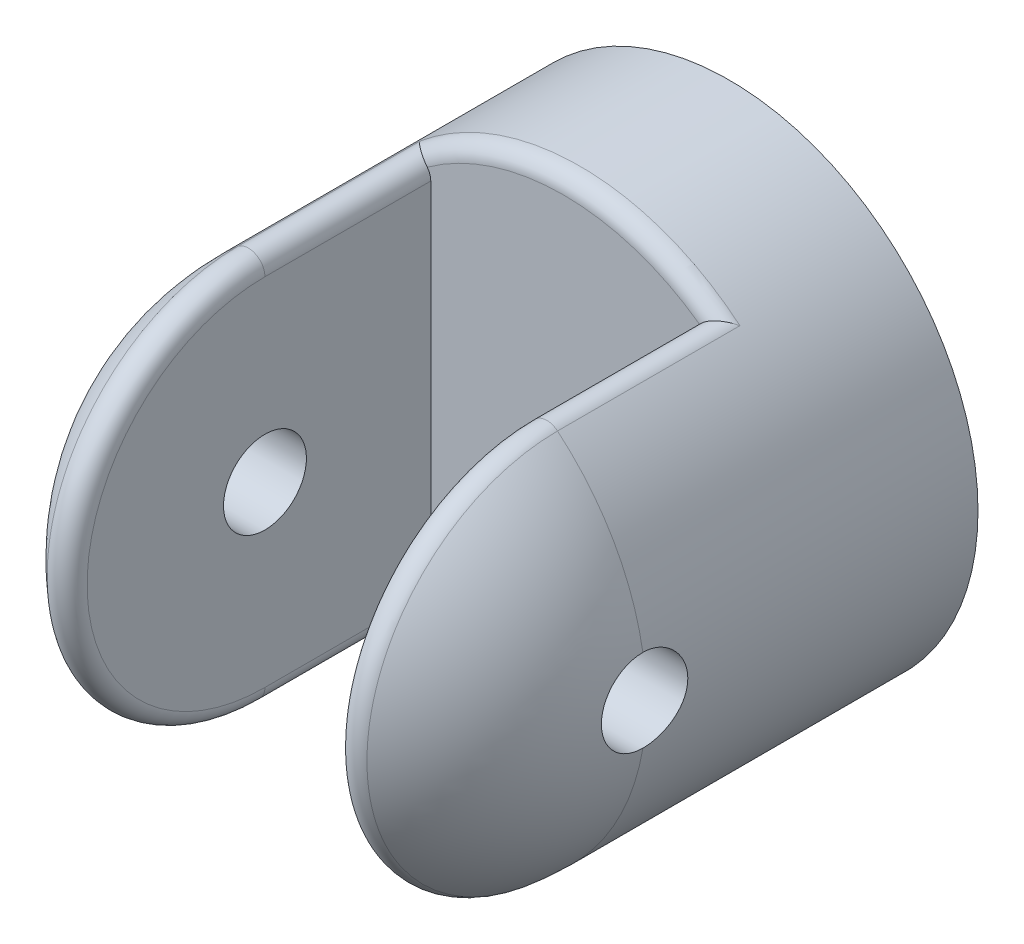
from build123d import *

# Parameters (mm, degrees)
CROQUIS1_R                 = 7.5
SALIENTE_EXTRUIR1_DEPTH    = 10
C_PULA1_FACE_RADIUS        = 7.5
C_PULA1_HEIGHT             = 7.5
CORTAR_EXTRUIR1_DEPTH      = 10
CORTAR_EXTRUIR1_DEPTH_BACK = 19
CORTAR_EXTRUIR2_DEPTH      = 11
CORTAR_EXTRUIR2_DEPTH_BACK = 19
CROQUIS3_R                 = 1.25
REDONDEO1_R                = 0.5


with BuildPart() as part:
    # Croquis1 → Saliente-Extruir1 (new body)
    with BuildSketch(Plane.XY):
        Circle(CROQUIS1_R)
    extrude(amount=SALIENTE_EXTRUIR1_DEPTH)

    # Cúpula1: a dome of height H over a round flat face of radius A is a cap of a sphere of radius (A * A + H * H) / (2 * H)
    c_pula1_r = (C_PULA1_FACE_RADIUS * C_PULA1_FACE_RADIUS + C_PULA1_HEIGHT * C_PULA1_HEIGHT) / (2 * C_PULA1_HEIGHT)
    c_pula1_base = Plane((0, 0, 10), z_dir=(0, 0, 1))
    with Locations(c_pula1_base.offset(C_PULA1_HEIGHT - c_pula1_r)):
        c_pula1_ball = Sphere(c_pula1_r, mode=Mode.PRIVATE)
    add(split(c_pula1_ball, bisect_by=c_pula1_base, keep=Keep.TOP, mode=Mode.PRIVATE))

    # Croquis2 → Cortar-Extruir1 (cut, two sides: drawn at the far end of the back side and taken through both)
    with BuildSketch(Plane(origin=(0, 0, 0), x_dir=(1, 0, 0), z_dir=(0, 1, 0)).offset(-CORTAR_EXTRUIR1_DEPTH_BACK)):
        Polygon((-4, -10), (-4, -17.5), (4, -17.5), (4, -9.5), (4, -5), (-4, -5), align=None)
    extrude(amount=CORTAR_EXTRUIR1_DEPTH + CORTAR_EXTRUIR1_DEPTH_BACK, mode=Mode.SUBTRACT)

    # Croquis3 → Cortar-Extruir2 (cut, two sides: drawn at the far end of the back side and taken through both)
    with BuildSketch(Plane(origin=(0, 0, 0), x_dir=(0, 0, -1), z_dir=(1, 0, 0)).offset(-CORTAR_EXTRUIR2_DEPTH_BACK)):
        with Locations(Location((-10, 0, 0), (0, 0, 270))):
            Circle(CROQUIS3_R)
    extrude(amount=CORTAR_EXTRUIR2_DEPTH + CORTAR_EXTRUIR2_DEPTH_BACK, mode=Mode.SUBTRACT)

    # Redondeo1
    # the kernel refuses this fillet: 0.5 mm, written as the material it takes off along each edge
    with BuildSketch(Plane(origin=(0, 0, 5), x_dir=(-0.6663010614300323, 0.7456828384354923, 0), z_dir=(-0.7456828384354923, -0.6663010614300323, 0))) as redondeo1_piece_1_section:
        with BuildLine():
            CenterArc((7.5 - REDONDEO1_R, REDONDEO1_R), REDONDEO1_R, 270, 90)
            Line((7.5 - REDONDEO1_R, 0), (7.5, 0))
            Line((7.5, 0), (7.5, REDONDEO1_R))
        make_face()
    redondeo1_piece_1 = revolve(axis=Axis((0, 0, 5), (0, 0, -1)), revolution_arc=83.564433706, mode=Mode.PRIVATE)
    redondeo1_piece_1 = split(redondeo1_piece_1, bisect_by=Plane(origin=(4, 7.359307854, 4.859307854), z_dir=(-1, 0, 0)), keep=Keep.TOP, mode=Mode.PRIVATE)
    redondeo1_piece_1 = split(redondeo1_piece_1, bisect_by=Plane(origin=(-4, 7.359307854, 4.859307854), z_dir=(1, 0, 0)), keep=Keep.TOP, mode=Mode.PRIVATE)
    add(redondeo1_piece_1, mode=Mode.SUBTRACT)
    with BuildSketch(Plane(origin=(4, -6.34428877, 10), x_dir=(0.807803952835934, 0.5894512480117758, 0), z_dir=(0, 0, -1)), Plane(origin=(-4, 6.34428877, 10), x_dir=(-0.8078039528359331, -0.5894512480117771, 0), z_dir=(0, 0, -1))) as redondeo1_piece_2:
        with BuildLine():
            CenterArc((0.982970703, -0.498849769), REDONDEO1_R, 86.112875875, 130.005200885)
            Line((0.579068726, -0.793575393), (0, 0))
            ThreePointArc((0, 0), (0.508433122, 0.017253461), (1.016866244, 0))
        make_face()
    extrude(amount=5, mode=Mode.SUBTRACT)
    with BuildSketch(Plane(origin=(4, 6.34428877, 10), x_dir=(0.8078039528359339, -0.5894512480117758, 0), z_dir=(0, 0, -1)), Plane(origin=(-4, -6.34428877, 10), x_dir=(-0.8078039528359333, 0.5894512480117767, 0), z_dir=(0, 0, -1))) as redondeo1_piece_3:
        with BuildLine():
            CenterArc((0.982970703, 0.498849769), REDONDEO1_R, 143.88192324, 130.005200885)
            Line((0.579068726, 0.793575393), (0, 0))
            ThreePointArc((0, 0), (0.508433122, -0.017253461), (1.016866244, 0))
        make_face()
    extrude(amount=5, mode=Mode.SUBTRACT)
    with BuildSketch(Plane(origin=(-4, 0, 10), x_dir=(0, 1, 0), z_dir=(0, 0, -1))) as redondeo1_piece_4:
        with BuildLine():
            CenterArc((5.361902647, -0.5), REDONDEO1_R, 319.994799115, 130.005200885)
            ThreePointArc((5.744895694, -0.821428571), (6.058529646, -0.42088436), (6.34428877, 0))
            Line((6.34428877, 0), (5.361902647, 0))
        make_face()
    revolve(axis=Axis((-4, 0, 10), (1, 0, 0)), revolution_arc=180, mode=Mode.SUBTRACT)
    with BuildSketch(Plane(origin=(4, 0, 10), x_dir=(0, 1, 0), z_dir=(0, 0, -1))) as redondeo1_piece_5:
        with BuildLine():
            CenterArc((5.361902647, 0.5), REDONDEO1_R, 270, 130.005200885)
            Line((5.361902647, 0), (6.34428877, 0))
            ThreePointArc((6.34428877, 0), (6.058529646, 0.42088436), (5.744895694, 0.821428571))
        make_face()
    revolve(axis=Axis((4, 0, 10), (1, 0, 0)), revolution_arc=180, mode=Mode.SUBTRACT)
    with BuildSketch(Plane(origin=(0, 0, 5), x_dir=(0.6663010614300334, -0.7456828384354912, 0), z_dir=(0.7456828384354912, 0.6663010614300334, 0))) as redondeo1_piece_6_section:
        with BuildLine():
            CenterArc((7.5 - REDONDEO1_R, REDONDEO1_R), REDONDEO1_R, 270, 90)
            Line((7.5 - REDONDEO1_R, 0), (7.5, 0))
            Line((7.5, 0), (7.5, REDONDEO1_R))
        make_face()
    redondeo1_piece_6 = revolve(axis=Axis((0, 0, 5), (0, 0, -1)), revolution_arc=83.564433706, mode=Mode.PRIVATE)
    redondeo1_piece_6 = split(redondeo1_piece_6, bisect_by=Plane(origin=(4, -7.359307854, 4.859307854), z_dir=(-1, 0, 0)), keep=Keep.TOP, mode=Mode.PRIVATE)
    redondeo1_piece_6 = split(redondeo1_piece_6, bisect_by=Plane(origin=(-4, -7.359307854, 4.859307854), z_dir=(1, 0, 0)), keep=Keep.TOP, mode=Mode.PRIVATE)
    add(redondeo1_piece_6, mode=Mode.SUBTRACT)
    with BuildSketch(Plane(origin=(-4, 6.34428877, 10), x_dir=(-0.8078039528359331, -0.5894512480117771, 0), z_dir=(0, 0, -1))) as redondeo1_piece_7a_section:
        with BuildLine():
            CenterArc((0.982970703, -0.498849769), REDONDEO1_R, 86.112875875, 130.005200885)
            Line((0.579068726, -0.793575393), (0, 0))
            ThreePointArc((0, 0), (0.508433122, 0.017253461), (1.016866244, 0))
        make_face()
    redondeo1_piece_7a = extrude(amount=7.54216561, mode=Mode.PRIVATE)
    redondeo1_piece_7a = split(redondeo1_piece_7a, bisect_by=Plane(origin=(-4.209576919, 5.957871406, 5), z_dir=(0, 0, -1)), keep=Keep.TOP, mode=Mode.PRIVATE)
    with BuildSketch(Plane(origin=(0, 0, 5), x_dir=(-0.6663010614300323, 0.7456828384354923, 0), z_dir=(-0.7456828384354923, -0.6663010614300323, 0))) as redondeo1_piece_7b_section:
        with BuildLine():
            CenterArc((7.5 - REDONDEO1_R, REDONDEO1_R), REDONDEO1_R, 270, 90)
            Line((7.5 - REDONDEO1_R, 0), (7.5, 0))
            Line((7.5, 0), (7.5, REDONDEO1_R))
        make_face()
    redondeo1_piece_7b = revolve(axis=Axis((0, 0, 5), (0, 0, -1)), revolution_arc=83.564433706, mode=Mode.PRIVATE)
    redondeo1_piece_7b = split(redondeo1_piece_7b, bisect_by=Plane(origin=(-4, 5.878976183, 4.882052038), z_dir=(-1, 0, 0)), keep=Keep.TOP, mode=Mode.PRIVATE)
    redondeo1_piece_7 = redondeo1_piece_7a & redondeo1_piece_7b
    add(redondeo1_piece_7, mode=Mode.SUBTRACT)
    with BuildSketch(Plane(origin=(0, 0, 5), x_dir=(-0.6663010614300323, 0.7456828384354923, 0), z_dir=(-0.7456828384354923, -0.6663010614300323, 0))) as redondeo1_piece_8a_section:
        with BuildLine():
            CenterArc((7.5 - REDONDEO1_R, REDONDEO1_R), REDONDEO1_R, 270, 90)
            Line((7.5 - REDONDEO1_R, 0), (7.5, 0))
            Line((7.5, 0), (7.5, REDONDEO1_R))
        make_face()
    redondeo1_piece_8a = revolve(axis=Axis((0, 0, 5), (0, 0, -1)), revolution_arc=83.564433706, mode=Mode.PRIVATE)
    redondeo1_piece_8a = split(redondeo1_piece_8a, bisect_by=Plane(origin=(4, 5.878976375, 4.882052003), z_dir=(1, 0, 0)), keep=Keep.TOP, mode=Mode.PRIVATE)
    with BuildSketch(Plane(origin=(4, 6.34428877, 10), x_dir=(0.8078039528359339, -0.5894512480117758, 0), z_dir=(0, 0, -1))) as redondeo1_piece_8b_section:
        with BuildLine():
            CenterArc((0.982970703, 0.498849769), REDONDEO1_R, 143.88192324, 130.005200885)
            Line((0.579068726, 0.793575393), (0, 0))
            ThreePointArc((0, 0), (0.508433122, -0.017253461), (1.016866244, 0))
        make_face()
    redondeo1_piece_8b = extrude(amount=7.54216561, mode=Mode.PRIVATE)
    redondeo1_piece_8b = split(redondeo1_piece_8b, bisect_by=Plane(origin=(4.209576919, 5.957871406, 5), z_dir=(0, 0, -1)), keep=Keep.TOP, mode=Mode.PRIVATE)
    redondeo1_piece_8 = redondeo1_piece_8a & redondeo1_piece_8b
    add(redondeo1_piece_8, mode=Mode.SUBTRACT)
    with BuildSketch(Plane(origin=(4, -6.34428877, 10), x_dir=(0.807803952835934, 0.5894512480117758, 0), z_dir=(0, 0, -1))) as redondeo1_piece_9a_section:
        with BuildLine():
            CenterArc((0.982970703, -0.498849769), REDONDEO1_R, 86.112875875, 130.005200885)
            Line((0.579068726, -0.793575393), (0, 0))
            ThreePointArc((0, 0), (0.508433122, 0.017253461), (1.016866244, 0))
        make_face()
    redondeo1_piece_9a = extrude(amount=7.54216561, mode=Mode.PRIVATE)
    redondeo1_piece_9a = split(redondeo1_piece_9a, bisect_by=Plane(origin=(4.209576919, -5.957871406, 5), z_dir=(0, 0, -1)), keep=Keep.TOP, mode=Mode.PRIVATE)
    with BuildSketch(Plane(origin=(0, 0, 5), x_dir=(0.6663010614300334, -0.7456828384354912, 0), z_dir=(0.7456828384354912, 0.6663010614300334, 0))) as redondeo1_piece_9b_section:
        with BuildLine():
            CenterArc((7.5 - REDONDEO1_R, REDONDEO1_R), REDONDEO1_R, 270, 90)
            Line((7.5 - REDONDEO1_R, 0), (7.5, 0))
            Line((7.5, 0), (7.5, REDONDEO1_R))
        make_face()
    redondeo1_piece_9b = revolve(axis=Axis((0, 0, 5), (0, 0, -1)), revolution_arc=83.564433706, mode=Mode.PRIVATE)
    redondeo1_piece_9b = split(redondeo1_piece_9b, bisect_by=Plane(origin=(4, -5.878976176, 4.88205204), z_dir=(1, 0, 0)), keep=Keep.TOP, mode=Mode.PRIVATE)
    redondeo1_piece_9 = redondeo1_piece_9a & redondeo1_piece_9b
    add(redondeo1_piece_9, mode=Mode.SUBTRACT)
    with BuildSketch(Plane(origin=(0, 0, 5), x_dir=(0.6663010614300334, -0.7456828384354912, 0), z_dir=(0.7456828384354912, 0.6663010614300334, 0))) as redondeo1_piece_10a_section:
        with BuildLine():
            CenterArc((7.5 - REDONDEO1_R, REDONDEO1_R), REDONDEO1_R, 270, 90)
            Line((7.5 - REDONDEO1_R, 0), (7.5, 0))
            Line((7.5, 0), (7.5, REDONDEO1_R))
        make_face()
    redondeo1_piece_10a = revolve(axis=Axis((0, 0, 5), (0, 0, -1)), revolution_arc=83.564433706, mode=Mode.PRIVATE)
    redondeo1_piece_10a = split(redondeo1_piece_10a, bisect_by=Plane(origin=(-4, -5.878976383, 4.882052), z_dir=(-1, 0, 0)), keep=Keep.TOP, mode=Mode.PRIVATE)
    with BuildSketch(Plane(origin=(-4, -6.34428877, 10), x_dir=(-0.8078039528359333, 0.5894512480117767, 0), z_dir=(0, 0, -1))) as redondeo1_piece_10b_section:
        with BuildLine():
            CenterArc((0.982970703, 0.498849769), REDONDEO1_R, 143.88192324, 130.005200885)
            Line((0.579068726, 0.793575393), (0, 0))
            ThreePointArc((0, 0), (0.508433122, -0.017253461), (1.016866244, 0))
        make_face()
    redondeo1_piece_10b = extrude(amount=7.54216561, mode=Mode.PRIVATE)
    redondeo1_piece_10b = split(redondeo1_piece_10b, bisect_by=Plane(origin=(-4.209576919, -5.957871406, 5), z_dir=(0, 0, -1)), keep=Keep.TOP, mode=Mode.PRIVATE)
    redondeo1_piece_10 = redondeo1_piece_10a & redondeo1_piece_10b
    add(redondeo1_piece_10, mode=Mode.SUBTRACT)


solid = part.part
